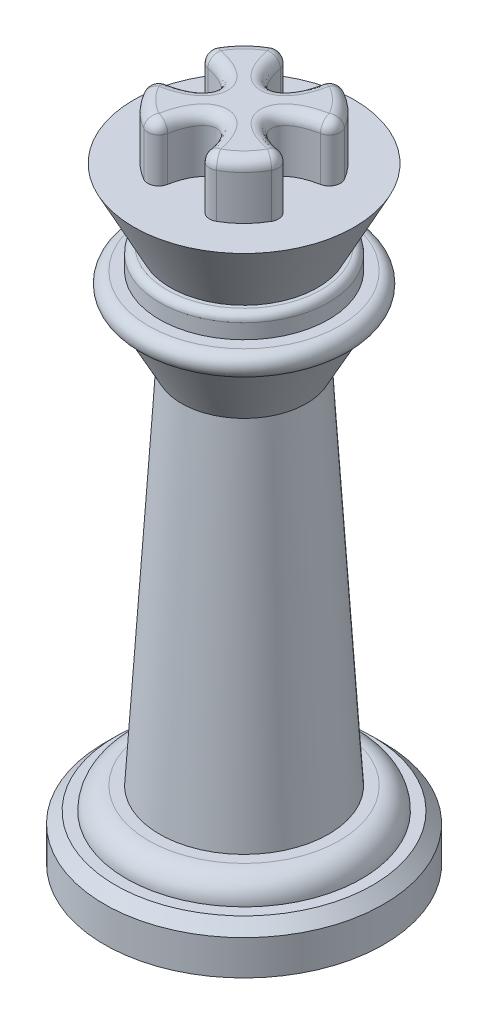
from build123d import *

# Parameters (mm, degrees)
FILLET2_R          = 1.524
CHAMFER1_SIZE      = 0.762
FILLET3_R          = 0.508
SKETCH2_RX         = 3.18469238
SKETCH2_RY         = 1.495075601
CUT_EXTRUDE1_DEPTH = 3.81
FILLET4_R          = 0.762


with BuildPart() as part:
    # Sketch1 → Revolve1 (revolve)
    with BuildSketch(Plane.XY, mode=Mode.PRIVATE) as revolve1_sk:
        with BuildLine():
            Line((0, 0), (-9.652, 0))
            Line((-9.652, 0), (-9.652, 3.175))
            Line((-9.652, 3.175), (-8.128, 3.175))
            Line((-8.128, 3.175), (-8.128, 4.699))
            Line((-8.128, 4.699), (-5.842, 4.699))
            Line((-5.842, 4.699), (-4.318, 29.707436315))
            Line((-4.318, 29.707436315), (-6.604, 33.968286919))
            ThreePointArc((-6.604, 33.968286919), (-7.366, 34.730286919), (-6.604, 35.492286919))
            Line((-6.604, 35.492286919), (-5.842, 35.492286919))
            Line((-5.842, 35.492286919), (-5.842, 37.016286919))
            Line((-5.842, 37.016286919), (-5.08, 37.016286919))
            Line((-5.08, 37.016286919), (-7.62, 41.91))
            Line((-7.62, 41.91), (-5.08, 41.91))
            Line((-5.08, 41.91), (-5.08, 45.72))
            Line((-5.08, 45.72), (0, 45.72))
            Line((0, 45.72), (0, 0))
        make_face()
    revolve(revolve1_sk.sketch.rotate(Axis((0, 0, 0), (0, 1, 0)), 270), axis=Axis((0, 0, 0), (0, 1, 0)))

    # Fillet2
    fillet2_edges = [part.edges().sort_by_distance(p)[0] for p in [
        (0, 4.699, 8.128),
    ]]
    fillet(fillet2_edges, radius=FILLET2_R - 0.0001)  # a hair under: the kernel refuses the full size

    # Chamfer1
    chamfer1_edges = [part.edges().sort_by_distance(p)[0] for p in [
        (0, 3.175, 9.652),
    ]]
    chamfer(chamfer1_edges, length=CHAMFER1_SIZE)

    # Fillet3
    fillet3_edges = [part.edges().sort_by_distance(p)[0] for p in [
        (0, 37.016286919, 5.842),
    ]]
    fillet(fillet3_edges, radius=FILLET3_R)

    # Sketch2 → Cut-Extrude1 (cut)
    with BuildSketch(Plane(origin=(0, 45.72, 0), x_dir=(1, 0, 0), z_dir=(0, 1, 0))):
        with Locations(Location((0, 5.08), (0, 0, 90))):
            Ellipse(SKETCH2_RX, SKETCH2_RY)
        with Locations(Location((5.08, 0), (0, 0, 180))):
            Ellipse(SKETCH2_RX, SKETCH2_RY)
        with Locations(Location((0, -5.08), (0, 0, -90))):
            Ellipse(SKETCH2_RX, SKETCH2_RY)
        with Locations(Location((-5.08, 0), (0, 0, 180))):
            Ellipse(SKETCH2_RX, SKETCH2_RY)
    extrude(amount=-CUT_EXTRUDE1_DEPTH, mode=Mode.SUBTRACT)

    # Fillet4
    fillet4_edges = [part.edges().sort_by_distance(p)[0] for p in [
        (3.106064938, 45.72, 1.173251988),
        (3.592102448, 45.72, 3.592102448),
        (-0.000114607, 45.72, 1.89530763),
        (-3.592102448, 45.72, 3.592102448),
        (-1.89530763, 45.72, -0.000114607),
        (-3.592102448, 45.72, -3.592102448),
        (0.000114607, 45.72, -1.89530763),
        (3.592102448, 45.72, -3.592102448),
        (-4.856149959, 43.815, 1.491377746),
        (-4.856149959, 43.815, -1.491377746),
        (1.491377746, 43.815, 4.856149959),
        (-1.491377746, 43.815, 4.856149959),
        (4.856149959, 43.815, 1.491377746),
        (4.856149959, 43.815, -1.491377746),
        (-1.491377746, 43.815, -4.856149959),
        (1.491377746, 43.815, -4.856149959),
    ]]
    fillet(fillet4_edges, radius=FILLET4_R)


solid = part.part
